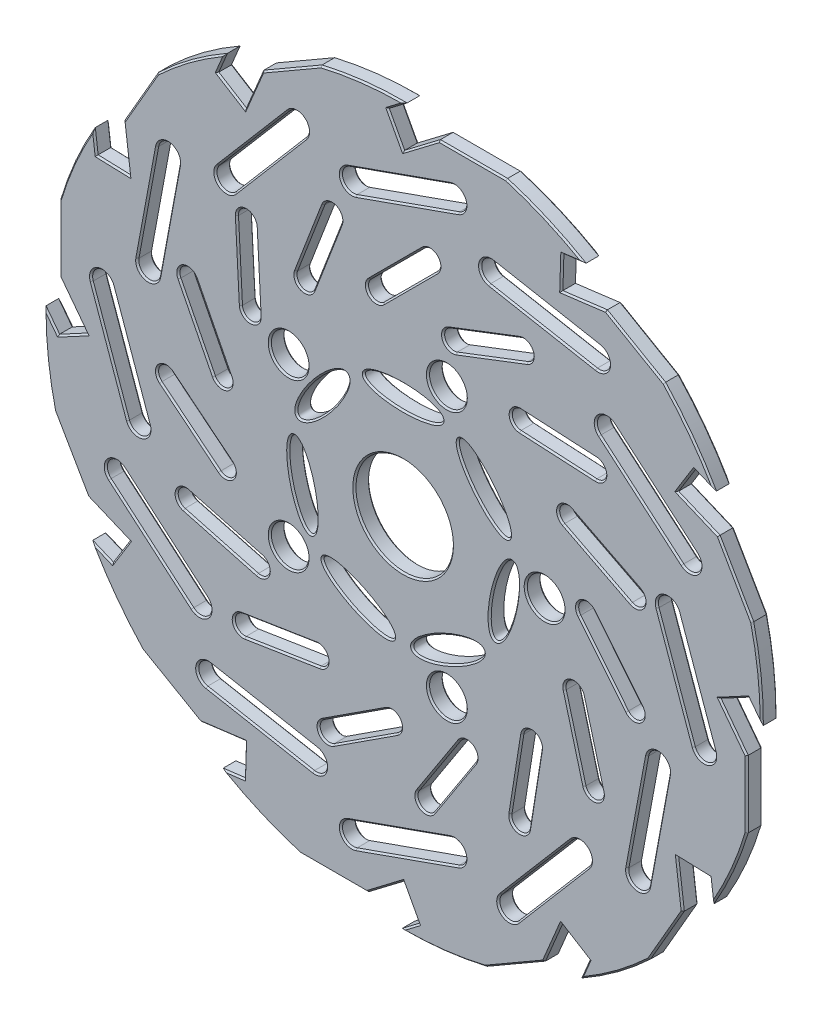
from build123d import *

# Parameters (mm, degrees)
SKETCH1_R           = 228.10069753
SKETCH1_R_2         = 31
BOSS_EXTRUDE1_DEPTH = 5
CUT_EXTRUDE1_DEPTH  = 36
CIRPATTERN1_COUNT   = 15
SKETCH3_RX          = 24.993360737
SKETCH3_RY          = 7.285116895
CUT_EXTRUDE2_DEPTH  = 36
CIRPATTERN2_COUNT   = 7
CUT_EXTRUDE3_DEPTH  = 51
CIRPATTERN3_COUNT   = 12
SKETCH5_R           = 12
CUT_EXTRUDE4_DEPTH  = 50
CIRPATTERN4_COUNT   = 5
CHAMFER1_SIZE       = 1


with BuildPart() as part:
    # Sketch1 → Boss-Extrude1 (new, symmetric)
    with BuildSketch(Plane.XY):
        Circle(SKETCH1_R)
        Circle(SKETCH1_R_2, mode=Mode.SUBTRACT)
    extrude(amount=BOSS_EXTRUDE1_DEPTH, both=True)

    # Sketch2 → Cut-Extrude1 (cut)
    with BuildSketch(Plane.XY.offset(5)):
        with BuildLine():
            Line((21.280209877, 145.389168887), (-12.85939778, 111.24956123))
            ThreePointArc((-12.85939778, 111.24956123), (-21.280209877, 111.24956123), (-21.280209877, 119.670373326))
            Line((-21.280209877, 119.670373326), (12.85939778, 153.809980983))
            ThreePointArc((12.85939778, 153.809980983), (21.280209877, 153.809980983), (21.280209877, 145.389168887))
        make_face()
    cut_extrude1 = extrude(amount=-CUT_EXTRUDE1_DEPTH, mode=Mode.SUBTRACT)

    # CirPattern1: Cut-Extrude1 ×15 about axis
    cirpattern1_axis = Axis((0, 0, 5.5), (0, 0, -1))
    for i in range(1, CIRPATTERN1_COUNT):
        add(cut_extrude1.rotate(cirpattern1_axis, i * 360 / CIRPATTERN1_COUNT), mode=Mode.SUBTRACT)

    # Sketch3 → Cut-Extrude2 (cut)
    with BuildSketch(Plane.XY.offset(5)):
        with Locations((0, 65.671584462)):
            Ellipse(SKETCH3_RX, SKETCH3_RY)
    cut_extrude2 = extrude(amount=-CUT_EXTRUDE2_DEPTH, mode=Mode.SUBTRACT)

    # CirPattern2: Cut-Extrude2 ×7 about axis
    cirpattern2_axis = Axis((0, 0, 5.5), (0, 0, -1))
    for i in range(1, CIRPATTERN2_COUNT):
        add(cut_extrude2.rotate(cirpattern2_axis, i * 360 / CIRPATTERN2_COUNT), mode=Mode.SUBTRACT)

    # Sketch4 → Cut-Extrude3 (cut)
    with BuildSketch(Plane.XY.offset(5)):
        with BuildLine():
            Line((34.886799842, 184.815987336), (-30.19659273, 161.760807356))
            ThreePointArc((-30.19659273, 161.760807356), (-39.161783202, 166.035790716), (-34.886799842, 175.000981189))
            Line((-34.886799842, 175.000981189), (30.19659273, 198.05616117))
            ThreePointArc((30.19659273, 198.05616117), (39.161783202, 193.781177809), (34.886799842, 184.815987336))
        make_face()
        Polygon((0, 201.212572636), (22.742836825, 218.498862302), (76.635386959, 218.498862302), (-24.540249614, 246.461977938), (4.956999883, 230.674266979), (-9.791624865, 219.464187888), align=None)
    cut_extrude3 = extrude(amount=-CUT_EXTRUDE3_DEPTH, mode=Mode.SUBTRACT)

    # CirPattern3: Cut-Extrude3 ×12 about axis
    cirpattern3_axis = Axis((0, 0, 5.5), (0, 0, -1))
    for i in range(1, CIRPATTERN3_COUNT):
        add(cut_extrude3.rotate(cirpattern3_axis, i * 360 / CIRPATTERN3_COUNT), mode=Mode.SUBTRACT)

    # Sketch5 → Cut-Extrude4 (cut)
    with BuildSketch(Plane.XY.offset(5)):
        with Locations((90, 0)):
            Circle(SKETCH5_R)
    cut_extrude4 = extrude(amount=-CUT_EXTRUDE4_DEPTH, mode=Mode.SUBTRACT)

    # CirPattern4: Cut-Extrude4 ×5 about axis
    cirpattern4_axis = Axis((0, 0, 5.5), (0, 0, -1))
    for i in range(1, CIRPATTERN4_COUNT):
        add(cut_extrude4.rotate(cirpattern4_axis, i * 360 / CIRPATTERN4_COUNT), mode=Mode.SUBTRACT)

    # Chamfer1
    chamfer1_edges = [part.edges().sort_by_distance(p)[0] for p in [
        (-31, 0, -5),
        (-21.280209877, 111.24956123, -5),
        (-4.210406048, 136.740177155, -5),
        (21.280209877, 153.809980983, -5),
        (4.210406048, 128.319365058, -5),
        (25.808834008, 110.286972455, -5),
        (51.770843309, 126.630894139, -5),
        (82.000594407, 131.856968338, -5),
        (56.038585106, 115.513046654, -5),
        (68.435296026, 90.254764218, -5),
        (98.800443535, 94.625979121, -5),
        (128.542331213, 87.104687984, -5),
        (98.177183704, 82.733473081, -5),
        (99.228673647, 54.616687308, -5),
        (128.7465495, 46.259372663, -5),
        (152.857931181, 27.291215757, -5),
        (123.340055327, 35.648530402, -5),
        (112.864512129, 9.534888986, -5),
        (136.431207431, -10.105899582, -5),
        (150.743006177, -37.241155608, -5),
        (127.176310876, -17.60036704, -5),
        (106.985051123, -37.195578264, -5),
        (120.525670158, -64.723769979, -5),
        (122.563245949, -95.334192843, -5),
        (109.022626914, -67.806001127, -5),
        (82.606902849, -77.49459212, -5),
        (83.780149574, -108.150312551, -5),
        (73.191187043, -136.943082051, -5),
        (72.017940318, -106.287361621, -5),
        (43.945270612, -104.394086983, -5),
        (32.548280009, -132.876683567, -5),
        (11.163706977, -154.873268284, -5),
        (22.56069758, -126.3906717, -5),
        (-2.314898144, -113.242895816, -5),
        (-24.311482861, -134.627468848, -5),
        (-52.794079445, -146.024459451, -5),
        (-30.797494728, -124.639886419, -5),
        (-48.174799981, -102.510979183, -5),
        (-76.967569481, -113.099941713, -5),
        (-107.623289911, -111.926694989, -5),
        (-78.830520411, -101.337732458, -5),
        (-85.704841246, -74.053982966, -5),
        (-116.31526411, -72.016407175, -5),
        (-143.843455825, -58.47578814, -5),
        (-113.233032962, -60.513363931, -5),
        (-108.415736856, -32.792380335, -5),
        (-135.550992883, -18.480581588, -5),
        (-155.19178145, 5.086113713, -5),
        (-128.056525424, -9.225685034, -5),
        (-112.380566638, 14.139322765, -5),
        (-131.348723544, 38.250704446, -5),
        (-139.706038189, 67.7685803, -5),
        (-120.737881283, 43.657198619, -5),
        (-96.913775503, 58.626208508, -5),
        (-104.435066639, 88.368096185, -5),
        (-100.063851736, 118.733243694, -5),
        (-92.542560599, 88.991356017, -5),
        (-64.689712149, 92.976090197, -5),
        (-59.46363795, 123.205841295, -5),
        (-43.119716266, 149.167850596, -5),
        (-48.345790465, 118.938099498, -5),
        (-24.993360735, 65.671584451, -5),
        (35.761006704, 60.486159459, -5),
        (69.586606702, 9.75342269, -5),
        (51.012072542, -48.323840288, -5),
        (-5.975592689, -70.012265905, -5),
        (-58.463514756, -38.980027308, -5),
        (-66.92721776, 21.404966902, -5),
        (-39.161783202, 166.035790716, -5),
        (-2.345103556, 186.52857118, -5),
        (39.161783202, 193.781177809, -5),
        (2.345103556, 173.288397346, -5),
        (49.102796247, 163.372104299, -5),
        (91.233366336, 162.711032951, -5),
        (130.805688015, 148.238531157, -5),
        (88.675117927, 148.899602505, -5),
        (124.210321097, 116.932994469, -5),
        (160.365929395, 95.295204844, -5),
        (187.400314359, 62.975489794, -5),
        (151.244706061, 84.613279419, -5),
        (166.035790716, 39.161783202, -5),
        (186.52857118, 2.345103556, -5),
        (193.781177809, -39.161783202, -5),
        (173.288397346, -2.345103556, -5),
        (163.372104299, -49.102796247, -5),
        (162.711032951, -91.233366336, -5),
        (148.238531157, -130.805688015, -5),
        (148.899602505, -88.675117927, -5),
        (116.932994469, -124.210321097, -5),
        (95.295204844, -160.365929395, -5),
        (62.975489794, -187.400314359, -5),
        (84.613279419, -151.244706061, -5),
        (39.161783202, -166.035790716, -5),
        (2.345103556, -186.52857118, -5),
        (-39.161783202, -193.781177809, -5),
        (-2.345103556, -173.288397346, -5),
        (-49.102796247, -163.372104299, -5),
        (-91.233366336, -162.711032951, -5),
        (-130.805688015, -148.238531157, -5),
        (-88.675117927, -148.899602505, -5),
        (-124.210321097, -116.932994469, -5),
        (-160.365929395, -95.295204844, -5),
        (-187.400314359, -62.975489794, -5),
        (-151.244706061, -84.613279419, -5),
        (-166.035790716, -39.161783202, -5),
        (-186.52857118, -2.345103556, -5),
        (-193.781177809, 39.161783202, -5),
        (-173.288397346, 2.345103556, -5),
        (-163.372104299, 49.102796247, -5),
        (-162.711032951, 91.233366336, -5),
        (-148.238531157, 130.805688015, -5),
        (-148.899602505, 88.675117927, -5),
        (-116.932994469, 124.210321097, -5),
        (-95.295204844, 160.365929395, -5),
        (-62.975489794, 187.400314359, -5),
        (-84.613279419, 151.244706061, -5),
        (-167.16881591, 147.452842007, -5),
        (-176.054673252, 114.775795957, -5),
        (-184.606286914, 100.929292192, -5),
        (-195.855862371, 108.327218828, -5),
        (-209.121397275, 91.094288601, -5),
        (-218.498862302, 44.113499083, -5),
        (-209.855717469, 11.371418413, -5),
        (-210.338380262, -4.895812433, -5),
        (-223.779761707, -4.113807759, -5),
        (-226.651586815, -25.670730569, -5),
        (-211.282314993, -71.046020295, -5),
        (-187.426091664, -95.079921512, -5),
        (-179.710474482, -109.40908807, -5),
        (-191.742054611, -115.452542879, -5),
        (-183.450666706, -135.557298214, -5),
        (-147.452842007, -167.16881591, -5),
        (-114.775795957, -176.054673252, -5),
        (-100.929292192, -184.606286914, -5),
        (-108.327218828, -195.855862371, -5),
        (-91.094288601, -209.121397275, -5),
        (-44.113499083, -218.498862302, -5),
        (-11.371418413, -209.855717469, -5),
        (4.895812433, -210.338380262, -5),
        (4.113807759, -223.779761707, -5),
        (25.670730569, -226.651586815, -5),
        (71.046020295, -211.282314993, -5),
        (95.079921512, -187.426091664, -5),
        (109.40908807, -179.710474482, -5),
        (115.452542879, -191.742054611, -5),
        (135.557298214, -183.450666706, -5),
        (167.16881591, -147.452842007, -5),
        (176.054673252, -114.775795957, -5),
        (184.606286914, -100.929292192, -5),
        (195.855862371, -108.327218828, -5),
        (209.121397275, -91.094288601, -5),
        (218.498862302, -44.113499083, -5),
        (209.855717469, -11.371418413, -5),
        (210.338380262, 4.895812433, -5),
        (223.779761707, 4.113807759, -5),
        (226.651586815, 25.670730569, -5),
        (211.282314993, 71.046020295, -5),
        (187.426091664, 95.079921512, -5),
        (179.710474482, 109.40908807, -5),
        (191.742054611, 115.452542879, -5),
        (183.450666706, 135.557298214, -5),
        (147.452842007, 167.16881591, -5),
        (114.775795957, 176.054673252, -5),
        (100.929292192, 184.606286914, -5),
        (108.327218828, 195.855862371, -5),
        (91.094288601, 209.121397275, -5),
        (44.113499083, 218.498862302, -5),
        (11.371418413, 209.855717469, -5),
        (-4.895812433, 210.338380262, -5),
        (-4.113807759, 223.779761707, -5),
        (-25.670730569, 226.651586815, -5),
        (-71.046020295, 211.282314993, -5),
        (-95.079921512, 187.426091664, -5),
        (-109.40908807, 179.710474482, -5),
        (-115.452542879, 191.742054611, -5),
        (-135.557298214, 183.450666706, -5),
        (78, 0, -5),
        (24.103325561, -74.182408271, -5),
        (-63.103325561, -45.847249679, -5),
        (-63.103325561, 45.847249679, -5),
        (24.103325561, 74.182408271, -5),
        (-31, 0, 5),
        (-4.210406048, 136.740177155, 5),
        (-21.280209877, 111.24956123, 5),
        (4.210406048, 128.319365058, 5),
        (21.280209877, 153.809980983, 5),
        (51.770843309, 126.630894139, 5),
        (25.808834008, 110.286972455, 5),
        (56.038585106, 115.513046654, 5),
        (82.000594407, 131.856968338, 5),
        (98.800443535, 94.625979121, 5),
        (68.435296026, 90.254764218, 5),
        (98.177183704, 82.733473081, 5),
        (128.542331213, 87.104687984, 5),
        (128.7465495, 46.259372663, 5),
        (99.228673647, 54.616687308, 5),
        (123.340055327, 35.648530402, 5),
        (152.857931181, 27.291215757, 5),
        (136.431207431, -10.105899582, 5),
        (112.864512129, 9.534888986, 5),
        (127.176310876, -17.60036704, 5),
        (150.743006177, -37.241155608, 5),
        (120.525670158, -64.723769979, 5),
        (106.985051123, -37.195578264, 5),
        (109.022626914, -67.806001127, 5),
        (122.563245949, -95.334192843, 5),
        (83.780149574, -108.150312551, 5),
        (82.606902849, -77.49459212, 5),
        (72.017940318, -106.287361621, 5),
        (73.191187043, -136.943082051, 5),
        (32.548280009, -132.876683567, 5),
        (43.945270612, -104.394086983, 5),
        (22.56069758, -126.3906717, 5),
        (11.163706977, -154.873268284, 5),
        (-24.311482861, -134.627468848, 5),
        (-2.314898144, -113.242895816, 5),
        (-30.797494728, -124.639886419, 5),
        (-52.794079445, -146.024459451, 5),
        (-76.967569481, -113.099941713, 5),
        (-48.174799981, -102.510979183, 5),
        (-78.830520411, -101.337732458, 5),
        (-107.623289911, -111.926694989, 5),
        (-116.31526411, -72.016407175, 5),
        (-85.704841246, -74.053982966, 5),
        (-113.233032962, -60.513363931, 5),
        (-143.843455825, -58.47578814, 5),
        (-135.550992883, -18.480581588, 5),
        (-108.415736856, -32.792380335, 5),
        (-128.056525424, -9.225685034, 5),
        (-155.19178145, 5.086113713, 5),
        (-131.348723544, 38.250704446, 5),
        (-112.380566638, 14.139322765, 5),
        (-120.737881283, 43.657198619, 5),
        (-139.706038189, 67.7685803, 5),
        (-104.435066639, 88.368096185, 5),
        (-96.913775503, 58.626208508, 5),
        (-92.542560599, 88.991356017, 5),
        (-100.063851736, 118.733243694, 5),
        (-59.46363795, 123.205841295, 5),
        (-64.689712149, 92.976090197, 5),
        (-48.345790465, 118.938099498, 5),
        (-43.119716266, 149.167850596, 5),
        (-24.969976857, 65.356522569, 5),
        (35.529261006, 60.27143933, 5),
        (69.274240666, 9.800732962, 5),
        (50.854304168, -48.050125224, 5),
        (-5.859960607, -69.718259073, 5),
        (-58.161555524, -38.887121846, 5),
        (-66.666312852, 21.226811283, 5),
        (-2.345103556, 186.52857118, 5),
        (-39.161783202, 166.035790716, 5),
        (2.345103556, 173.288397346, 5),
        (39.161783202, 193.781177809, 5),
        (91.233366336, 162.711032951, 5),
        (49.102796247, 163.372104299, 5),
        (88.675117927, 148.899602505, 5),
        (130.805688015, 148.238531157, 5),
        (160.365929395, 95.295204844, 5),
        (124.210321097, 116.932994469, 5),
        (151.244706061, 84.613279419, 5),
        (187.400314359, 62.975489794, 5),
        (186.52857118, 2.345103556, 5),
        (166.035790716, 39.161783202, 5),
        (173.288397346, -2.345103556, 5),
        (193.781177809, -39.161783202, 5),
        (162.711032951, -91.233366336, 5),
        (163.372104299, -49.102796247, 5),
        (148.899602505, -88.675117927, 5),
        (148.238531157, -130.805688015, 5),
        (95.295204844, -160.365929395, 5),
        (116.932994469, -124.210321097, 5),
        (84.613279419, -151.244706061, 5),
        (62.975489794, -187.400314359, 5),
        (2.345103556, -186.52857118, 5),
        (39.161783202, -166.035790716, 5),
        (-2.345103556, -173.288397346, 5),
        (-39.161783202, -193.781177809, 5),
        (-91.233366336, -162.711032951, 5),
        (-49.102796247, -163.372104299, 5),
        (-88.675117927, -148.899602505, 5),
        (-130.805688015, -148.238531157, 5),
        (-160.365929395, -95.295204844, 5),
        (-124.210321097, -116.932994469, 5),
        (-151.244706061, -84.613279419, 5),
        (-187.400314359, -62.975489794, 5),
        (-186.52857118, -2.345103556, 5),
        (-166.035790716, -39.161783202, 5),
        (-173.288397346, 2.345103556, 5),
        (-193.781177809, 39.161783202, 5),
        (-162.711032951, 91.233366336, 5),
        (-163.372104299, 49.102796247, 5),
        (-148.899602505, 88.675117927, 5),
        (-148.238531157, 130.805688015, 5),
        (-95.295204844, 160.365929395, 5),
        (-116.932994469, 124.210321097, 5),
        (-84.613279419, 151.244706061, 5),
        (-62.975489794, 187.400314359, 5),
        (-109.40908807, 179.710474482, 5),
        (-95.079921512, 187.426091664, 5),
        (-71.046020295, 211.282314993, 5),
        (-25.670730569, 226.651586815, 5),
        (-4.113807759, 223.779761707, 5),
        (-4.895812433, 210.338380262, 5),
        (11.371418413, 209.855717469, 5),
        (44.113499083, 218.498862302, 5),
        (91.094288601, 209.121397275, 5),
        (108.327218828, 195.855862371, 5),
        (100.929292192, 184.606286914, 5),
        (114.775795957, 176.054673252, 5),
        (147.452842007, 167.16881591, 5),
        (183.450666706, 135.557298214, 5),
        (191.742054611, 115.452542879, 5),
        (179.710474482, 109.40908807, 5),
        (187.426091664, 95.079921512, 5),
        (211.282314993, 71.046020295, 5),
        (226.651586815, 25.670730569, 5),
        (223.779761707, 4.113807759, 5),
        (210.338380262, 4.895812433, 5),
        (209.855717469, -11.371418413, 5),
        (218.498862302, -44.113499083, 5),
        (209.121397275, -91.094288601, 5),
        (195.855862371, -108.327218828, 5),
        (184.606286914, -100.929292192, 5),
        (176.054673252, -114.775795957, 5),
        (167.16881591, -147.452842007, 5),
        (135.557298214, -183.450666706, 5),
        (115.452542879, -191.742054611, 5),
        (109.40908807, -179.710474482, 5),
        (95.079921512, -187.426091664, 5),
        (71.046020295, -211.282314993, 5),
        (25.670730569, -226.651586815, 5),
        (4.113807759, -223.779761707, 5),
        (4.895812433, -210.338380262, 5),
        (-11.371418413, -209.855717469, 5),
        (-44.113499083, -218.498862302, 5),
        (-91.094288601, -209.121397275, 5),
        (-108.327218828, -195.855862371, 5),
        (-100.929292192, -184.606286914, 5),
        (-114.775795957, -176.054673252, 5),
        (-147.452842007, -167.16881591, 5),
        (-183.450666706, -135.557298214, 5),
        (-191.742054611, -115.452542879, 5),
        (-179.710474482, -109.40908807, 5),
        (-187.426091664, -95.079921512, 5),
        (-211.282314993, -71.046020295, 5),
        (-226.651586815, -25.670730569, 5),
        (-223.779761707, -4.113807759, 5),
        (-210.338380262, -4.895812433, 5),
        (-209.855717469, 11.371418413, 5),
        (-218.498862302, 44.113499083, 5),
        (-209.121397275, 91.094288601, 5),
        (-195.855862371, 108.327218828, 5),
        (-184.606286914, 100.929292192, 5),
        (-176.054673252, 114.775795957, 5),
        (-167.16881591, 147.452842007, 5),
        (-135.557298214, 183.450666706, 5),
        (-115.452542879, 191.742054611, 5),
        (78, 0, 5),
        (24.103325561, -74.182408271, 5),
        (-63.103325561, -45.847249679, 5),
        (-63.103325561, 45.847249679, 5),
        (24.103325561, 74.182408271, 5),
    ]]
    chamfer(chamfer1_edges, length=CHAMFER1_SIZE)


solid = part.part
